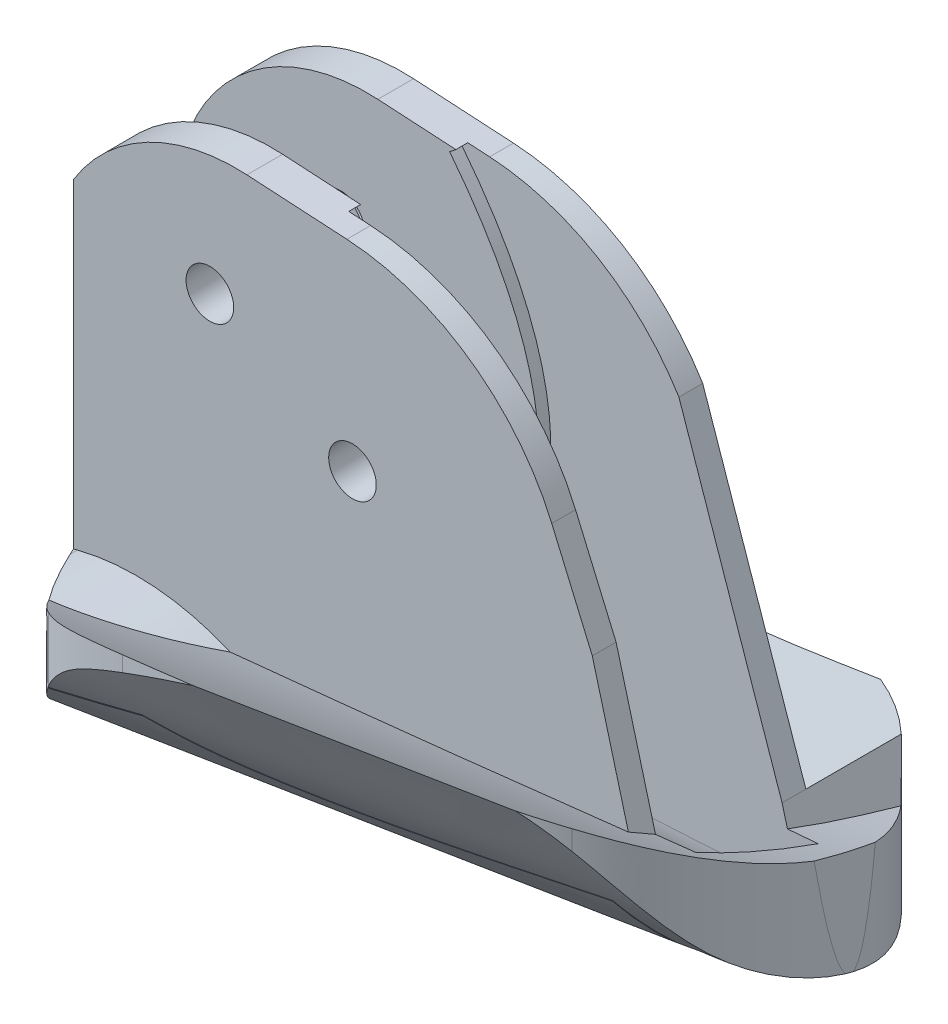
from build123d import *

# Parameters (mm, degrees)
SKETCH10_R               = 1
BOSS_EXTRUDE5_DEPTH      = 7.5
CUT_EXTRUDE1_DEPTH       = 4
FILLET1_R                = 10
CUT_EXTRUDE6_START       = -11
CUT_EXTRUDE6_DEPTH       = 10
CUT_EXTRUDE7_DEPTH       = 2
BOSS_EXTRUDE11_DEPTH     = 9
CUT_EXTRUDE9_DEPTH       = 9
FILLET2_R                = 8
FILLET3_R                = 10
BOSS_EXTRUDE15_DEPTH     = 2
CUT_EXTRUDE10_DEPTH      = 39
BOSS_EXTRUDE16_DEPTH     = 35
SKETCH36_R               = 26.434714878
CUT_EXTRUDE11_DEPTH      = 50
CUT_EXTRUDE13_DEPTH      = 2.5
FILLET5_R                = 3
CUT_EXTRUDE14_DEPTH      = 2
CUT_EXTRUDE15_DEPTH      = 10
CUT_EXTRUDE15_DEPTH_BACK = 10


with BuildPart() as part:
    # Sketch10 → Boss-Extrude5 (new, symmetric)
    with BuildSketch(Plane.XY):
        Polygon((29.817696335, 47.635346734), (33.959433176, 37.989988632), (36.993816658, 26.682834617), (12.788755024, 23.658848526), (10.279677841, 36.875809012), (12.321190148, 48.651294168), align=None)
        with Locations((17.890076876, 43.12952492)):
            Circle(SKETCH10_R, mode=Mode.SUBTRACT)
        with Locations((23.882298789, 39.668364252)):
            Circle(SKETCH10_R, mode=Mode.SUBTRACT)
    extrude(amount=BOSS_EXTRUDE5_DEPTH, both=True)

    # Sketch11 → Cut-Extrude1 (cut)
    with BuildSketch(Plane.XY.offset(7.5)):
        with BuildLine():
            Line((17.825431655, 32.423947427), (9.123672409, 30.207945799))
            Line((9.123672409, 30.207945799), (6.594316119, 53.15991455))
            Line((6.594316119, 53.15991455), (34.693470887, 60.271659822))
            Line((34.693470887, 60.271659822), (37.752907488, 30.846026516))
            add(Edge.make_bspline(
                [(37.752907488, 30.846026516), (30.679137573, 30.15507536), (19.269012528, 26.734198276), (17.825431655, 32.423947427)],
                knots=[0, 0, 0, 0, 1, 1, 1, 1], degree=3))
        make_face()
    extrude(amount=-CUT_EXTRUDE1_DEPTH, mode=Mode.SUBTRACT)

    # Fillet1
    fillet1_edges = [part.edges().sort_by_distance(p)[0] for p in [
        (29.817696335, 47.635346734, -2),
    ]]
    fillet(fillet1_edges, radius=FILLET1_R)

    # Sketch11<2> → Cut-Extrude6 (cut)
    with BuildSketch(Plane.XY.offset(7.5).offset(CUT_EXTRUDE6_START)):
        with BuildLine():
            Line((17.825431655, 32.423947427), (9.123672409, 30.207945799))
            Line((9.123672409, 30.207945799), (6.594316119, 53.15991455))
            Line((6.594316119, 53.15991455), (34.693470887, 60.271659822))
            Line((34.693470887, 60.271659822), (37.752907488, 30.846026516))
            add(Edge.make_bspline(
                [(37.752907488, 30.846026516), (30.679137573, 30.15507536), (19.269012528, 26.734198276), (17.825431655, 32.423947427)],
                knots=[0, 0, 0, 0, 1, 1, 1, 1], degree=3))
        make_face()
    extrude(amount=-CUT_EXTRUDE6_DEPTH, mode=Mode.SUBTRACT)

    # Sketch16 → Cut-Extrude7 (cut, symmetric)
    with BuildSketch(Plane.XY):
        Polygon((10.074284509, 54.36084815), (34.418624568, 54.36084815), (34.418624568, 36.664364271), (10.074284509, 40.645108775), align=None)
    extrude(amount=CUT_EXTRUDE7_DEPTH, both=True, mode=Mode.SUBTRACT)

    # Sketch26 → Boss-Extrude11 (add)
    with BuildSketch(Plane(origin=(41.188168375, 11.053240949, 0), x_dir=(0, 0, -1), z_dir=(0.9658266565657433, 0.2591888683316433, 0))):
        Polygon((2, 27.88983665), (2, 26.535626274), (-2, 26.535626274), (-2, 27.88983665), (-3.5, 27.88983665), (-3.5, 20.267140373), (-7.5, 20.267140373), (-7.5, 16.182607471), (7.5, 16.182607471), (7.5, 20.267140372), (3.5, 20.267140373), (3.5, 27.88983665), align=None)
    extrude(amount=BOSS_EXTRUDE11_DEPTH)

    # Sketch32 → Cut-Extrude9 (cut)
    with BuildSketch(Plane(origin=(49.880608284, 13.385940764, 0), x_dir=(0, 0, -1), z_dir=(0.9658266565657431, 0.25918886833164445, 0))):
        Polygon((3.5, 27.88983665), (2, 27.88983665), (2, 26.535626274), (-2, 26.535626274), (-2, 27.88983665), (-3.5, 27.88983665), (-3.5, 20.267140373), (-7.5, 20.267140373), (-7.5, 16.182607471), (7.5, 16.182607471), (7.5, 20.267140372), (3.5, 20.267140373), align=None)
    extrude(amount=-CUT_EXTRUDE9_DEPTH, mode=Mode.SUBTRACT)

    # Fillet2
    fillet2_edges = [part.edges().sort_by_distance(p)[0] for p in [
        (12.321190148, 48.651294168, 2.75),
        (12.321190148, 48.651294168, -2.75),
    ]]
    fillet(fillet2_edges, radius=FILLET2_R)

    # Fillet3
    fillet3_edges = [part.edges().sort_by_distance(p)[0] for p in [
        (17.825431655, 32.423947427, 5.5),
        (17.825431655, 32.423947427, -5.5),
    ]]
    fillet(fillet3_edges, radius=FILLET3_R)

    # Sketch33 → Boss-Extrude15 (add)
    with BuildSketch(Plane(origin=(0, 0, -7.5), x_dir=(-1, 0, 0), z_dir=(0, 0, -1))):
        with BuildLine():
            Line((-12.788755024, 23.658848526), (-11.433807645, 30.796247922))
            Line((-11.433807645, 30.796247922), (-12.326402939, 31.023557432))
            ThreePointArc((-12.326402939, 31.023557432), (-16.080274062, 31.249816591), (-19.652266177, 30.073545384))
            add(Edge.make_bspline(
                [(-19.652266177, 30.073545384), (-23.0941469, 28.16057184), (-30.349790115, 29.85862745), (-35.935151197, 30.627785373)],
                knots=[0.191602456, 0.191602456, 0.191602456, 0.191602456, 0.918085752, 0.918085752, 0.918085752, 0.918085752], degree=3))
            Line((-35.935151197, 30.627785373), (-36.993816658, 26.682834617))
            Line((-36.993816658, 26.682834617), (-12.788755024, 23.658848526))
        make_face()
    extrude(amount=BOSS_EXTRUDE15_DEPTH)

    # Sketch34 → Cut-Extrude10 (cut)
    with BuildSketch(Plane(origin=(38.461517044, 25.591062299, -2.646327476), x_dir=(0.15829413041500603, 0.00456516911323452, 0.9873814498496135), z_dir=(-0.9869710867739799, -0.028464036595566348, 0.15835994598658892))):
        with BuildLine():
            Line((-9.961265233, -0.738719639), (-10.539825219, -8.529669092))
            Line((-10.539825219, -8.529669092), (14.067052248, -4.634194365))
            Line((14.067052248, -4.634194365), (11.468841042, 6.956926756))
            Line((11.468841042, 6.956926756), (11.21027487, 7.304843188))
            Line((11.21027487, 7.304843188), (9.361931657, 9.097934771))
            add(Edge.make_bspline(
                [(9.361931657, 9.097934771), (8.080840594, 7.128731816), (6.182155155, 3.432947915), (1.212613563, 0.239722973), (-4.023408317, -1.262739339), (-7.989625603, -1.414236949), (-9.961265233, -0.738719639)],
                knots=[0, 0, 0, 0, 0.305306887, 0.51080958, 0.734727302, 1, 1, 1, 1], degree=3))
        make_face()
    extrude(amount=CUT_EXTRUDE10_DEPTH, mode=Mode.SUBTRACT)

    # Sketch35 → Boss-Extrude16 (add)
    with BuildSketch(Plane(origin=(38.461517044, 25.591062299, -2.646327476), x_dir=(0.15829413041500603, 0.00456516911323452, 0.9873814498496135), z_dir=(-0.9869710867739799, -0.028464036595566348, 0.15835994598658892))):
        with BuildLine():
            add(Edge.make_bspline(
                [(9.4004877, 9.184756896), (8.014929786, 7.018966969), (5.842518043, 2.878503648), (-1.139034542, -0.886617024), (-6.30542047, -1.596698786), (-9.578716562, -0.883058447)],
                knots=[0, 0, 0, 0, 0.341444372, 0.573297577, 1, 1, 1, 1], degree=3))
            add(Edge.make_bspline(
                [(9.4004877, 9.184756896), (3.32787198, 5.072103669), (-2.734752997, 1.774886575), (-13.141424705, 3.401162616), (-9.578716562, -0.883058447)],
                knots=[0, 0, 0, 0, 0, 1, 1, 1, 1, 1], degree=4))
        make_face()
    extrude(amount=BOSS_EXTRUDE16_DEPTH)

    # Sketch36 → Cut-Extrude11 (cut)
    with BuildSketch(Plane(origin=(0, 0, 0), x_dir=(1, 0, 0), z_dir=(0, 1, 0))):
        with Locations((26.225783332, -0.650291413)):
            Circle(SKETCH36_R)
        with BuildLine():
            Line((22.27470203, 9.70201848), (19.28016014, 8.542138611))
            add(Edge.make_bspline(
                [(19.28016014, 8.542138611), (18.175901997, 8.02209785), (17.104853981, 7.409710687), (15.075188036, 6.045530397), (14.110142212, 5.294388477), (13.198308873, 4.467057161)],
                knots=[0, 0, 0, 0, 0.5, 0.5, 1, 1, 1, 1], degree=3))
            add(Edge.make_bspline(
                [(13.198308873, 4.467057161), (12.856317377, 4.156758927), (12.521128574, 3.838013044), (12.062916373, 3.318460234), (11.91815484, 3.137535842), (11.661713857, 2.757043697), (11.550456081, 2.556507418), (11.455714424, 2.346031665)],
                knots=[0, 0, 0, 0, 0.5, 0.5, 0.75, 0.75, 1, 1, 1, 1], degree=3))
            add(Edge.make_bspline(
                [(11.455714424, 2.346031665), (11.284040059, 1.964644086), (11.16485619, 1.564947495), (11.008111608, 0.755442821), (10.971218182, 0.345401712), (10.98789158, -0.059156156)],
                knots=[0, 0, 0, 0, 0.5, 0.5, 1, 1, 1, 1], degree=3))
            add(Edge.make_bspline(
                [(10.98789158, -0.059156156), (10.99792158, -0.302520769), (11.02944628, -0.542488699), (11.12634683, -1.008711257), (11.19087416, -1.236563096), (11.410302161, -1.904902376), (11.588163497, -2.329957216), (11.780123254, -2.738257431)],
                knots=[0, 0, 0, 0, 0.25, 0.25, 0.5, 0.5, 1, 1, 1, 1], degree=3))
            add(Edge.make_bspline(
                [(11.780123254, -2.738257431), (11.91357793, -3.022116788), (12.05386597, -3.297269562), (12.195728557, -3.566331475)],
                knots=[0, 0, 0, 0, 1, 1, 1, 1], degree=3))
            add(Edge.make_bspline(
                [(12.195728557, -3.566331475), (12.411463271, -3.975502043), (12.630500313, -4.36877313), (13.077923556, -5.124332793), (13.305396924, -5.484478562), (13.784469569, -6.164821799), (14.038623175, -6.484734929), (14.587070822, -7.070943503), (14.880298966, -7.339084541), (15.189604703, -7.586330457)],
                knots=[0, 0, 0, 0, 0.25, 0.25, 0.5, 0.5, 0.75, 0.75, 1, 1, 1, 1], degree=3))
            add(Edge.make_bspline(
                [(15.189604703, -7.586330457), (15.484527228, -7.822079042), (15.790917234, -8.036380128), (16.451082548, -8.411819372), (16.805158657, -8.572703094), (17.60008374, -8.824782036), (18.030120375, -8.910944932), (18.925051233, -9.040134767), (19.385267736, -9.083946683), (19.847770317, -9.121583058)],
                knots=[0, 0, 0, 0, 0.25, 0.25, 0.5, 0.5, 0.75, 0.75, 1, 1, 1, 1], degree=3))
            add(Edge.make_bspline(
                [(19.847770317, -9.121583058), (20.375853971, -9.164556125), (20.90568312, -9.20026391), (21.963401198, -9.264462665), (22.492291454, -9.291642406), (24.079899428, -9.35758558), (25.138685282, -9.380681557), (26.225783332, -9.357302516)],
                knots=[0, 0, 0, 0, 0.25, 0.25, 0.5, 0.5, 1, 1, 1, 1], degree=3))
            ThreePointArc((26.225783332, -9.357302516), (29.135522917, -8.98002407), (32.045328198, -8.603252657))
            add(Edge.make_bspline(
                [(32.045328198, -8.603252657), (32.484857242, -8.475440114), (32.895008957, -8.331386668), (33.660733722, -8.009704849), (34.00893391, -7.836068963), (34.332027275, -7.648103897)],
                knots=[0, 0, 0, 0, 0.5, 0.5, 1, 1, 1, 1], degree=3))
            add(Edge.make_bspline(
                [(34.332027275, -7.648103897), (34.986829665, -7.267161457), (35.515098099, -6.839968082), (35.962895786, -6.347700951)],
                knots=[0, 0, 0, 0, 1, 1, 1, 1], degree=3))
            add(Edge.make_bspline(
                [(35.962895786, -6.347700951), (36.217673321, -6.067622223), (36.444572042, -5.771472761), (36.864366191, -5.144270772), (37.056224896, -4.813190072), (37.409085181, -4.11242964), (37.57010651, -3.7427783), (37.862184847, -2.960448803), (37.993551386, -2.545662841), (38.217781289, -1.687850228), (38.311536987, -1.243194379), (38.457020018, -0.320960637), (38.508907408, 0.156589114), (38.545365074, 0.899478523), (38.550501782, 1.152558758), (38.544056398, 1.661018247), (38.532558536, 1.91672128), (38.469145021, 2.687450512), (38.389101774, 3.20619335), (38.18502652, 3.987182111), (38.102568828, 4.247637925), (37.909070913, 4.753539957), (37.797769203, 5.000809197), (37.547107967, 5.484130164), (37.407750734, 5.720183397), (37.101959894, 6.181256328), (36.93469576, 6.407104102), (36.405911762, 7.054359847), (36.015122249, 7.450571298), (35.171278077, 8.185026799), (34.717166803, 8.523302018), (33.777912102, 9.130316752), (33.289845505, 9.402055779), (32.528307149, 9.758845099), (32.268400105, 9.8695554), (31.742955676, 10.068933287), (31.477765165, 10.157278993), (30.674717675, 10.388182685), (30.129373581, 10.496569888), (29.020328896, 10.630345177), (28.45541172, 10.655622251), (27.892174079, 10.647517977)],
                knots=[0, 0, 0, 0, 0.0625, 0.0625, 0.125, 0.125, 0.1875, 0.1875, 0.25, 0.25, 0.3125, 0.3125, 0.375, 0.375, 0.40625, 0.40625, 0.4375, 0.4375, 0.5, 0.5, 0.53125, 0.53125, 0.5625, 0.5625, 0.59375, 0.59375, 0.625, 0.625, 0.6875, 0.6875, 0.75, 0.75, 0.8125, 0.8125, 0.84375, 0.84375, 0.875, 0.875, 0.9375, 0.9375, 1, 1, 1, 1], degree=3))
            add(Edge.make_bspline(
                [(27.892174079, 10.647517977), (26.933414273, 10.633722642), (25.988610902, 10.528875138), (24.584544995, 10.286198743), (24.118853872, 10.190148513), (23.1920584, 9.96824464), (22.729958594, 9.842020448), (22.27470203, 9.70201848)],
                knots=[0, 0, 0, 0, 0.5, 0.5, 0.75, 0.75, 1, 1, 1, 1], degree=3))
        make_face(mode=Mode.SUBTRACT)
    extrude(amount=CUT_EXTRUDE11_DEPTH, mode=Mode.SUBTRACT)

    # Sketch38 → Cut-Extrude13 (cut, symmetric)
    with BuildSketch(Plane.XY):
        with BuildLine():
            Line((25.630505815, 35.197420962), (28.423953414, 17.491969512))
            Line((28.423953414, 17.491969512), (38.658608962, 12.202078844))
            Line((38.658608962, 12.202078844), (36.141575896, 49.028287034))
            Line((36.141575896, 49.028287034), (23.973363778, 49.028287034))
            Line((23.973363778, 49.028287034), (22.465197824, 47.841248074))
            add(Edge.make_bspline(
                [(22.465197824, 47.841248074), (27.708259845, 41.179792215), (25.630505815, 35.197420962)],
                knots=[0, 0, 0, 1, 1, 1], degree=2))
        make_face()
    extrude(amount=CUT_EXTRUDE13_DEPTH, both=True, mode=Mode.SUBTRACT)

    # Fillet5
    fillet5_edges = [part.edges().sort_by_distance(p)[0] for p in [
        (32.51380906, 25.144124896, -2.5),
    ]]
    fillet(fillet5_edges, radius=FILLET5_R)

    # Sketch39 → Cut-Extrude14 (cut)
    with BuildSketch(Plane(origin=(0, 0, -3.5), x_dir=(-1, 0, 0), z_dir=(0, 0, -1))):
        Polygon((-31.149589966, 44.533606687), (-35.935151197, 30.627785373), (-33.959433176, 37.989988632), align=None)
    extrude(amount=-CUT_EXTRUDE14_DEPTH, mode=Mode.SUBTRACT)

    # Sketch41 → Cut-Extrude15 (cut, two sides: drawn at the far end of the back side and taken through both)
    with BuildSketch(Plane(origin=(12.609381788, 32.832175874, 0), x_dir=(0.9335205757693716, -0.35852382712341585, 0), z_dir=(0.3585238271234158, 0.9335205757693715, 0)).offset(-CUT_EXTRUDE15_DEPTH_BACK)):
        with BuildLine():
            Line((5.556791969, 6), (10.556791969, 6))
            ThreePointArc((10.556791969, 6), (11.440675445, 5.633883476), (11.806791969, 4.75))
            ThreePointArc((11.806791969, 4.75), (11.440675445, 3.866116524), (10.556791969, 3.5))
            Line((10.556791969, 3.5), (5.556791969, 3.5))
            ThreePointArc((5.556791969, 3.5), (4.672908492, 3.866116524), (4.306791969, 4.75))
            ThreePointArc((4.306791969, 4.75), (4.672908492, 5.633883476), (5.556791969, 6))
        make_face()
    extrude(amount=CUT_EXTRUDE15_DEPTH + CUT_EXTRUDE15_DEPTH_BACK, mode=Mode.SUBTRACT)


solid = part.part
